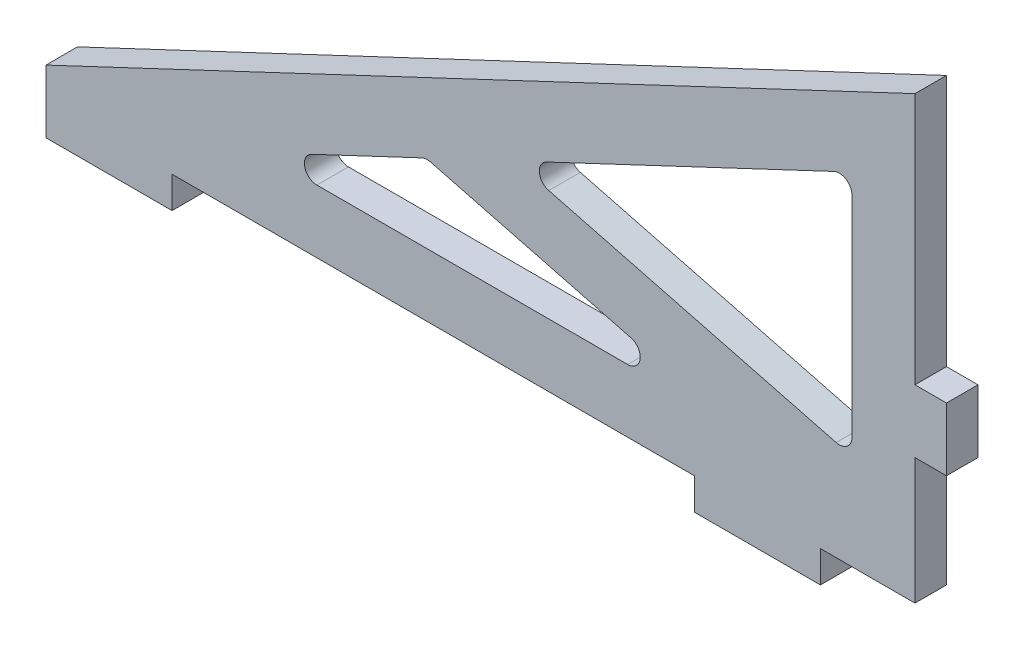
from build123d import *

# Parameters (mm, degrees)
BOSS_EXTRUDE1_DEPTH = 6.35
CUT_EXTRUDE1_DEPTH  = 251.331075005
FILLET1_R           = 2.54


with BuildPart() as part:
    # Sketch2 → Boss-Extrude1 (new body)
    with BuildSketch(Plane.XY):
        Polygon((-96.583174713, 148.30800019), (78.499984891, 230.861462734), (78.499984891, 180.05800019), (84.849984891, 180.05800019), (84.849984891, 167.35800019), (78.499984891, 167.35800019), (78.499984891, 141.95800019), (59.449984891, 141.95800019), (59.449984891, 135.60800019), (34.049984891, 135.60800019), (34.049984891, 141.95800019), (-71.183174713, 141.95800019), (-71.183174713, 135.60800019), (-96.583174713, 135.60800019), (-96.583174713, 141.95800019), align=None)
    extrude(amount=BOSS_EXTRUDE1_DEPTH)

    # Sketch3 → Cut-Extrude1 (cut, through all)
    with BuildSketch(Plane.XY.offset(6.35)):
        Polygon((-20.024514932, 170.365225127), (-53.337116072, 154.65800019), (40.515121465, 154.65800019), align=None)
        Polygon((65.799984891, 210.832335999), (-2.074925401, 178.828636287), (65.799984891, 161.218248334), align=None)
    extrude(amount=-CUT_EXTRUDE1_DEPTH, mode=Mode.SUBTRACT)

    # Fillet1
    fillet1_edges = [part.edges().sort_by_distance(p)[0] for p in [
        (65.799984891, 210.832335999, 3.175),
        (-2.074925401, 178.828636287, 3.175),
        (-20.024514932, 170.365225127, 3.175),
        (40.515121465, 154.65800019, 3.175),
        (-53.337116072, 154.65800019, 3.175),
        (65.799984891, 161.218248334, 3.175),
    ]]
    fillet(fillet1_edges, radius=FILLET1_R)


solid = part.part
